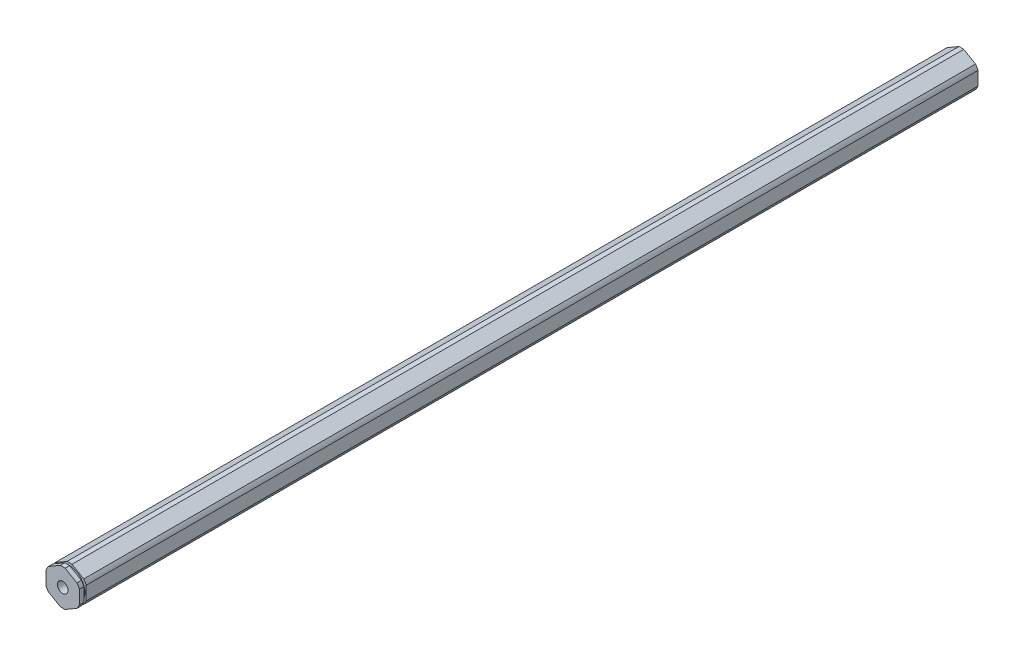
from build123d import *

# Parameters (mm, degrees)
BOSS_EXTRUDE1_DEPTH                  = 170.942
F_10_32_TAPPED_HOLE1_D               = 4.0386
F_10_32_TAPPED_HOLE1_DEPTH           = 16.34744
F_10_32_TAPPED_HOLE1_TIP             = 1.213317848
F_10_32_TAPPED_HOLE1_ON_FACE_2_D     = 4.0386
F_10_32_TAPPED_HOLE1_ON_FACE_2_DEPTH = 16.34744
F_10_32_TAPPED_HOLE1_ON_FACE_2_TIP   = 1.213317848
SKETCH5_W                            = 0.889
SKETCH5_H                            = 1.0033


with BuildPart() as part:
    # Sketch1 → Boss-Extrude1 (new, symmetric)
    with BuildSketch(Plane.XY):
        with BuildLine():
            ThreePointArc((0.93173274, 6.79441227), (0, 6.858), (-0.93173274, 6.79441227))
            Line((-0.93173274, 6.79441227), (-5.41826726, 4.204110358))
            ThreePointArc((-5.41826726, 4.204110358), (-5.939202219, 3.429), (-6.35, 2.590301913))
            Line((-6.35, 2.590301913), (-6.35, -2.590301913))
            ThreePointArc((-6.35, -2.590301913), (-5.939202219, -3.429), (-5.41826726, -4.204110358))
            Line((-5.41826726, -4.204110358), (-0.93173274, -6.79441227))
            ThreePointArc((-0.93173274, -6.79441227), (0, -6.858), (0.93173274, -6.79441227))
            Line((0.93173274, -6.79441227), (5.41826726, -4.204110358))
            ThreePointArc((5.41826726, -4.204110358), (5.939202219, -3.429), (6.35, -2.590301913))
            Line((6.35, -2.590301913), (6.35, 2.590301913))
            ThreePointArc((6.35, 2.590301913), (5.939202219, 3.429), (5.41826726, 4.204110358))
            Line((5.41826726, 4.204110358), (0.93173274, 6.79441227))
        make_face()
    extrude(amount=BOSS_EXTRUDE1_DEPTH, both=True)

    # #10-32 Tapped Hole1
    with Locations(Plane.XY.offset(170.942)):
        with Locations((0, 0)):
            Hole(F_10_32_TAPPED_HOLE1_D / 2, depth=F_10_32_TAPPED_HOLE1_DEPTH)
            with Locations((0, 0, -(F_10_32_TAPPED_HOLE1_DEPTH + F_10_32_TAPPED_HOLE1_TIP / 2))):  # 118° drill point
                Cone(0, F_10_32_TAPPED_HOLE1_D / 2, F_10_32_TAPPED_HOLE1_TIP, mode=Mode.SUBTRACT)

    # #10-32 Tapped Hole1 on face 2
    with Locations(Plane(origin=(0, 0, -170.942), x_dir=(-1, 0, 0), z_dir=(0, 0, -1))):
        with Locations((0, 0)):
            Hole(F_10_32_TAPPED_HOLE1_ON_FACE_2_D / 2, depth=F_10_32_TAPPED_HOLE1_ON_FACE_2_DEPTH)
            with Locations((0, 0, -(F_10_32_TAPPED_HOLE1_ON_FACE_2_DEPTH + F_10_32_TAPPED_HOLE1_ON_FACE_2_TIP / 2))):  # 118° drill point
                Cone(0, F_10_32_TAPPED_HOLE1_ON_FACE_2_D / 2, F_10_32_TAPPED_HOLE1_ON_FACE_2_TIP, mode=Mode.SUBTRACT)

    # Sketch5 → Cut-Revolve1 (revolve, cut)
    with BuildSketch(Plane(origin=(0, 0, 0), x_dir=(0, 0, -1), z_dir=(1, 0, 0))):
        with Locations((-168.783, 6.35635)):
            Rectangle(SKETCH5_W, SKETCH5_H)
    revolve(axis=Axis((0, 0, 165.047176272), (0, 0, -1)), mode=Mode.SUBTRACT)


solid = part.part
